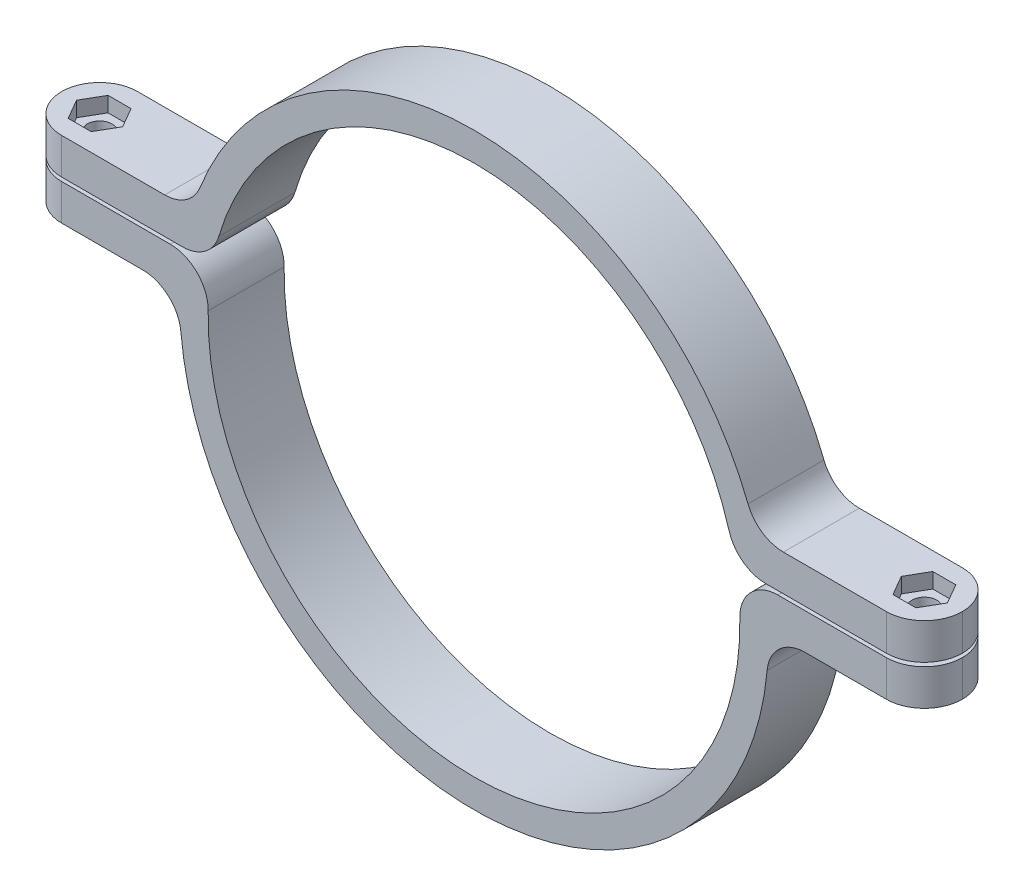
from build123d import *

# Parameters (mm, degrees)
SKETCH2_R               = 70
BOSS_EXTRUDE1_DEPTH     = 20
CUT_EXTRUDE1_DEPTH      = 251.274252393
CUT_EXTRUDE1_DEPTH_BACK = 251.274252393
SKETCH4_W               = 20
SKETCH4_H               = 1
FILLET1_R               = 10
FILLET2_R               = 10
FILLET3_R               = 10
FILLET4_R               = 10
CUT_EXTRUDE2_DEPTH      = 4
SKETCH6_R               = 3.25
CUT_EXTRUDE3_DEPTH      = 154.551254807


with BuildPart() as part:
    # Sketch2 → Boss-Extrude1 (new body)
    with BuildSketch(Plane.XY):
        with BuildLine():
            Line((-118.56533158, 2), (-77.47418925, 2))
            ThreePointArc((-77.47418925, 2), (0, -77.5), (77.47418925, 2))
            Line((77.47418925, 2), (118.56533158, 2))
            Line((118.56533158, 2), (118.56533158, 22))
            Line((118.56533158, 22), (74.311842932, 22))
            ThreePointArc((74.311842932, 22), (0, 77.5), (-74.311842932, 22))
            Line((-74.311842932, 22), (-118.56533158, 22))
            Line((-118.56533158, 22), (-118.56533158, 2))
        make_face()
        Circle(SKETCH2_R, mode=Mode.SUBTRACT)
    extrude(amount=-BOSS_EXTRUDE1_DEPTH)

    # Sketch4 → Cut-Extrude1 (cut, two sides: drawn at the far end of the back side and taken through both)
    with BuildSketch(Plane.ZY.offset(118.56533158).offset(-CUT_EXTRUDE1_DEPTH_BACK)):
        with Locations((-10, 12)):
            Rectangle(SKETCH4_W, SKETCH4_H)
    extrude(amount=CUT_EXTRUDE1_DEPTH + CUT_EXTRUDE1_DEPTH_BACK, mode=Mode.SUBTRACT)


with BuildPart() as cut_extrude1_piece_1:
    # of the separate pieces the step leaves, piece 1, a body of its own (cut_extrude1_pieces)
    add(part.part.solids().sort_by_distance((-118.56533158, 11.5, 0))[0])

    # Fillet2
    fillet2_edges = [cut_extrude1_piece_1.edges().sort_by_distance(p)[0] for p in [
        (-77.47418925, 2, -10),
        (77.47418925, 2, -10),
        (-69.048895719, 11.5, -10),
        (69.048895719, 11.5, -10),
    ]]
    fillet(fillet2_edges, radius=FILLET2_R)

    # Fillet4
    fillet4_edges = [cut_extrude1_piece_1.edges().sort_by_distance(p)[0] for p in [
        (118.56533158, 6.75, 0),
        (118.56533158, 6.75, -20),
        (-118.56533158, 6.75, 0),
        (-118.56533158, 6.75, -20),
    ]]
    fillet(fillet4_edges, radius=FILLET4_R - 0.0001)  # a hair under: the kernel refuses the full size


with BuildPart() as cut_extrude1_piece_2:
    # of the separate pieces the step leaves, piece 2, a body of its own (cut_extrude1_pieces)
    add(part.part.solids().sort_by_distance((-74.311842932, 22, 0))[0])

    # Fillet1
    fillet1_edges = [cut_extrude1_piece_2.edges().sort_by_distance(p)[0] for p in [
        (-74.311842932, 22, -10),
        (74.311842932, 22, -10),
        (68.87488657, 12.5, -10),
        (-68.87488657, 12.5, -10),
    ]]
    fillet(fillet1_edges, radius=FILLET1_R)

    # Fillet3
    fillet3_edges = [cut_extrude1_piece_2.edges().sort_by_distance(p)[0] for p in [
        (-118.56533158, 17.25, 0),
        (-118.56533158, 17.25, -20),
        (118.56533158, 17.25, 0),
        (118.56533158, 17.25, -20),
    ]]
    fillet(fillet3_edges, radius=FILLET3_R - 0.0001)  # a hair under: the kernel refuses the full size

    # Sketch5 → Cut-Extrude2 (cut)
    with BuildSketch(Plane(origin=(0, 22, 0), x_dir=(-1, 0, 0), z_dir=(0, -1, 0))):
        Polygon((-114.627509104, 10.001916974), (-111.594760194, 15.250958224), (-105.532582671, 15.249041251), (-102.503154057, 9.998083026), (-105.535902967, 4.749041776), (-111.59808049, 4.750958749), align=None)
        Polygon((111.594760194, 15.250958224), (105.532582671, 15.249041251), (102.503154057, 9.998083026), (105.535902967, 4.749041776), (111.59808049, 4.750958749), (114.627509104, 10.001916974), align=None)
    extrude(amount=CUT_EXTRUDE2_DEPTH, mode=Mode.SUBTRACT)


with BuildPart() as cut_extrude3_tool:
    # Sketch6 → Cut-Extrude3 (new, through all)
    with BuildSketch(Plane(origin=(0, 18, 0), x_dir=(-1, 0, 0), z_dir=(0, -1, 0))):
        with BuildLine():
            ThreePointArc((111.81533158, 10), (110.189886548, 12.814839455), (106.939441638, 12.814068566))
            Line((106.939441638, 12.814068566), (110.191221523, 7.185931434))
            ThreePointArc((110.191221523, 7.185931434), (111.380171035, 8.375445032), (111.81533158, 10))
        make_face()
        with BuildLine():
            Line((110.191221523, 7.185931434), (106.939441638, 12.814068566))
            ThreePointArc((106.939441638, 12.814068566), (105.751263014, 8.374110058), (110.191221523, 7.185931434))
        make_face()
        with Locations(Location((-108.56533158, 10, 0), (0, 0, 270))):
            Circle(SKETCH6_R)
    extrude(amount=CUT_EXTRUDE3_DEPTH)


with BuildPart() as cut_extrude1_piece_1_1:
    add(cut_extrude1_piece_1.part)

    # Cut-Extrude3: cut by cut_extrude3_tool
    add(cut_extrude3_tool.part, mode=Mode.SUBTRACT)


with BuildPart() as cut_extrude1_piece_2_1:
    add(cut_extrude1_piece_2.part)

    # Cut-Extrude3: cut by cut_extrude3_tool
    add(cut_extrude3_tool.part, mode=Mode.SUBTRACT)


solid = Compound([cut_extrude1_piece_1_1.part, cut_extrude1_piece_2_1.part])
